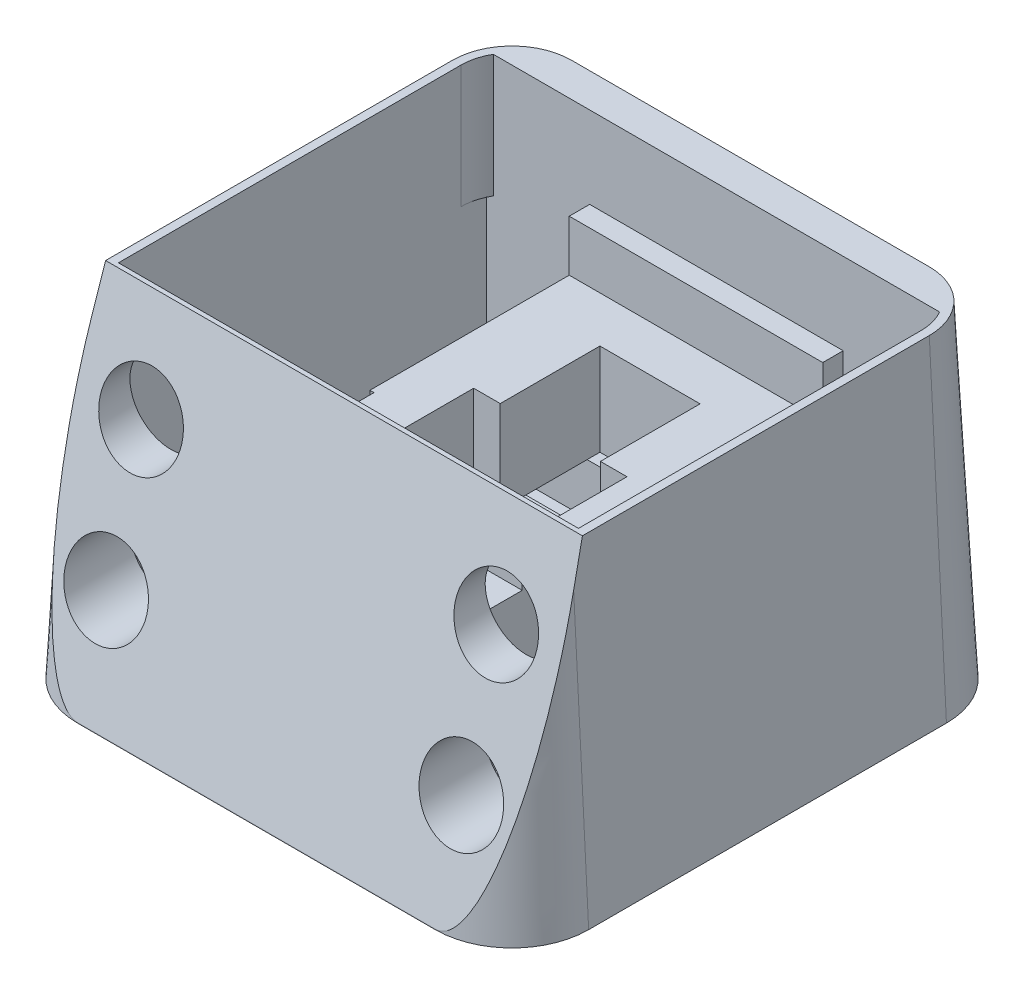
from build123d import *

# Parameters (mm, degrees)
BOSS_EXTRUDE1_DEPTH  = 10
SKETCH2_W            = 17.2
SKETCH2_H            = 43
CUT_EXTRUDE1_DEPTH   = 72.414284285
SKETCH3_W            = 90
SKETCH3_H            = 34
SKETCH3_W_2          = 80
SKETCH3_H_2          = 24
BOSS_EXTRUDE3_DEPTH  = 15
SKETCH4_W            = 49.6
SKETCH4_H            = 5
BOSS_EXTRUDE4_DEPTH  = 10
SKETCH5_W            = 15
SKETCH5_H            = 22
BOSS_EXTRUDE5_DEPTH  = 5
SKETCH6_W            = 90
SKETCH6_H            = 77
BOSS_EXTRUDE6_DEPTH  = 15
BOSS_EXTRUDE8_DEPTH  = 39
CHAMFER1_SIZE        = 64
CHAMFER1_SIZE_2      = 3.354097874
CHAMFER3_SIZE        = 64
CHAMFER3_SIZE_2      = 13.775745352
CUT_EXTRUDE6_DEPTH   = 2.5
CUT_EXTRUDE8_DEPTH   = 15
CUT_EXTRUDE9_DEPTH   = 15
SKETCH22_W           = 30
SKETCH22_H           = 7
CUT_EXTRUDE10_DEPTH  = 10
SKETCH25_R           = 8
CUT_EXTRUDE19_DEPTH  = 116.41230437
SKETCH29_W           = 9
SKETCH29_H           = 29
BOSS_EXTRUDE10_DEPTH = 28
SKETCH31_W           = 49.6
SKETCH31_H           = 13
BOSS_EXTRUDE12_DEPTH = 28
SKETCH30_W           = 49.6
SKETCH30_H           = 4
SKETCH30_W_2         = 48
BOSS_EXTRUDE11_DEPTH = 10
SKETCH33_W           = 15
SKETCH33_H           = 19.5
BOSS_EXTRUDE13_DEPTH = 13
SKETCH23_W           = 30
SKETCH23_H           = 28.995403325
CUT_EXTRUDE17_DEPTH  = 5
SKETCH34_W           = 9.8
SKETCH34_H           = 10.5
BOSS_EXTRUDE14_DEPTH = 28
SKETCH35_W           = 30
SKETCH35_H           = 10.5
CUT_EXTRUDE22_DEPTH  = 5
SKETCH37_W           = 30
SKETCH37_H           = 32.5
BOSS_EXTRUDE15_DEPTH = 5


with BuildPart() as part:
    # Sketch1 → Boss-Extrude1 (new body)
    with BuildSketch(Plane(origin=(0, 0, 0), x_dir=(1, 0, 0), z_dir=(0, 1, 0))):
        with BuildLine():
            Line((-35, 50), (35, 50))
            ThreePointArc((35, 50), (45.606601718, 45.606601718), (50, 35))
            Line((50, 35), (50, -35))
            ThreePointArc((50, -35), (45.606601718, -45.606601718), (35, -50))
            Line((35, -50), (-35, -50))
            ThreePointArc((-35, -50), (-45.606601718, -45.606601718), (-50, -35))
            Line((-50, -35), (-50, 35))
            ThreePointArc((-50, 35), (-45.606601718, 45.606601718), (-35, 50))
        make_face()
    extrude(amount=BOSS_EXTRUDE1_DEPTH)

    # Sketch2 → Cut-Extrude1 (cut, through all)
    with BuildSketch(Plane(origin=(0, 10, 0), x_dir=(1, 0, 0), z_dir=(0, 1, 0))):
        with Locations((-33.4, 18.5)):
            Rectangle(SKETCH2_W, SKETCH2_H)
        with Locations((33.4, 18.5)):
            Rectangle(SKETCH2_W, SKETCH2_H)
    extrude(amount=-CUT_EXTRUDE1_DEPTH, mode=Mode.SUBTRACT)

    # Sketch3 → Boss-Extrude3 (add)
    with BuildSketch(Plane(origin=(0, 10, 0), x_dir=(1, 0, 0), z_dir=(0, 1, 0))):
        with Locations((0, -20)):
            Rectangle(SKETCH3_W, SKETCH3_H)
        with Locations((0, -20)):
            Rectangle(SKETCH3_W_2, SKETCH3_H_2, mode=Mode.SUBTRACT)
    extrude(amount=BOSS_EXTRUDE3_DEPTH)

    # Sketch4 → Boss-Extrude4 (add)
    with BuildSketch(Plane(origin=(0, 10, 0), x_dir=(1, 0, 0), z_dir=(0, 1, 0))):
        with Locations((0, 10)):
            Rectangle(SKETCH4_W, SKETCH4_H)
        with Locations((0, 27)):
            Rectangle(SKETCH4_W, SKETCH4_H)
    extrude(amount=BOSS_EXTRUDE4_DEPTH)

    # Sketch5 → Boss-Extrude5 (add)
    with BuildSketch(Plane(origin=(0, 20, 0), x_dir=(1, 0, 0), z_dir=(0, 1, 0))):
        with Locations((-17.3, 18.5)):
            Rectangle(SKETCH5_W, SKETCH5_H)
        with Locations((17.3, 18.5)):
            Rectangle(SKETCH5_W, SKETCH5_H)
    extrude(amount=BOSS_EXTRUDE5_DEPTH)

    # Sketch6 → Boss-Extrude6 (add)
    with BuildSketch(Plane(origin=(0, 10, 0), x_dir=(1, 0, 0), z_dir=(0, 1, 0))):
        with BuildLine():
            Line((-50, 35), (-50, -35))
            ThreePointArc((-50, -35), (-45.606601718, -45.606601718), (-35, -50))
            Line((-35, -50), (35, -50))
            ThreePointArc((35, -50), (45.606601718, -45.606601718), (50, -35))
            Line((50, -35), (50, 35))
            ThreePointArc((50, 35), (45.606601718, 45.606601718), (35, 50))
            Line((35, 50), (-35, 50))
            ThreePointArc((-35, 50), (-45.606601718, 45.606601718), (-50, 35))
        make_face()
        with Locations((0, 1.5)):
            Rectangle(SKETCH6_W, SKETCH6_H, mode=Mode.SUBTRACT)
    extrude(amount=BOSS_EXTRUDE6_DEPTH)

    # Sketch9 → Boss-Extrude8 (add)
    with BuildSketch(Plane(origin=(0, 25, 0), x_dir=(1, 0, 0), z_dir=(0, 1, 0))):
        with BuildLine():
            Line((-50, 35), (-50, -35))
            ThreePointArc((-50, -35), (-45.606601718, -45.606601718), (-35, -50))
            Line((-35, -50), (35, -50))
            ThreePointArc((35, -50), (45.606601718, -45.606601718), (50, -35))
            Line((50, -35), (50, 35))
            ThreePointArc((50, 35), (45.606601718, 45.606601718), (35, 50))
            Line((35, 50), (-35, 50))
            ThreePointArc((-35, 50), (-45.606601718, 45.606601718), (-50, 35))
        make_face()
        with BuildLine():
            Line((-45, 35), (-45, -32))
            Line((-45, -32), (45, -32))
            Line((45, -32), (45, 35))
            ThreePointArc((45, 35), (44.659258263, 37.588190451), (43.660254038, 40))
            Line((43.660254038, 40), (-43.660254038, 40))
            ThreePointArc((-43.660254038, 40), (-44.659258263, 37.588190451), (-45, 35))
        make_face(mode=Mode.SUBTRACT)
    extrude(amount=BOSS_EXTRUDE8_DEPTH)

    # Chamfer1
    # the kernel refuses this chamfer: 64, 3.354097874 mm, written as the material it takes off along each edge
    with BuildSketch(Plane(origin=(-35, 64, 50), x_dir=(0, -0.9999979738662979, 0.002013023422382214), z_dir=(1, 0, 0)), Plane(origin=(50, 64, 35), x_dir=(0.002013023422382214, -0.9999979738662979, 0), z_dir=(0, 0, -1)), Plane(origin=(-50, 64, -35), x_dir=(-0.002013023422382214, -0.9999979738662979, 0), z_dir=(0, 0, 1)), Plane(origin=(35, 64, -50), x_dir=(0, -0.9999979738662979, -0.002013023422382214), z_dir=(-1, 0, 0))) as chamfer1_piece_1:
        Polygon((CHAMFER1_SIZE * 0.999997973866, CHAMFER1_SIZE * 0.00201302342238), (-CHAMFER1_SIZE_2 * 0.00201302342245, CHAMFER1_SIZE_2 * 0.9999979739), (0, 0), align=None)
    extrude(amount=70, mode=Mode.SUBTRACT)
    with BuildSketch(Plane(origin=(35, 64, 35), x_dir=(0, 0, 1), z_dir=(-1, 0, 0))) as chamfer1_piece_2:
        Polygon((15, -CHAMFER1_SIZE), (15 - CHAMFER1_SIZE_2, 0), (15, 0), align=None)
    revolve(axis=Axis((35, 64, 35), (0, 1, 0)), revolution_arc=90, mode=Mode.SUBTRACT)
    with BuildSketch(Plane(origin=(-35, 64, 35), x_dir=(-1, 0, 0), z_dir=(0, 0, -1))) as chamfer1_piece_3:
        Polygon((15, -CHAMFER1_SIZE), (15 - CHAMFER1_SIZE_2, 0), (15, 0), align=None)
    revolve(axis=Axis((-35, 64, 35), (0, 1, 0)), revolution_arc=90, mode=Mode.SUBTRACT)
    with BuildSketch(Plane(origin=(35, 64, -35), x_dir=(1, 0, 0), z_dir=(0, 0, 1))) as chamfer1_piece_4:
        Polygon((15, -CHAMFER1_SIZE), (15 - CHAMFER1_SIZE_2, 0), (15, 0), align=None)
    revolve(axis=Axis((35, 64, -35), (0, 1, 0)), revolution_arc=90, mode=Mode.SUBTRACT)
    with BuildSketch(Plane(origin=(-35, 64, -35), x_dir=(0, 0, -1), z_dir=(1, 0, 0))) as chamfer1_piece_5:
        Polygon((15 - CHAMFER1_SIZE_2, 0), (15, -CHAMFER1_SIZE), (15, 0), align=None)
    revolve(axis=Axis((-35, 64, -35), (0, 1, 0)), revolution_arc=90, mode=Mode.SUBTRACT)

    # Chamfer3
    # the kernel refuses this chamfer: 64, 13.775745352 mm, written as the material it takes off along each edge
    with BuildSketch(Plane(origin=(-201.265469314, 64, 46.645902126), x_dir=(0, -0.9981787050157903, 0.06032638604292662), z_dir=(1, 0, 0))) as chamfer3_piece_1:
        Polygon((CHAMFER3_SIZE * 0.999967974892, CHAMFER3_SIZE * 0.00800307379952), (-CHAMFER3_SIZE_2 * 0.060326386045, CHAMFER3_SIZE_2 * 0.99817870505), (0, 0), align=None)
    extrude(amount=402.530938629, mode=Mode.SUBTRACT)

    # Sketch17 → Cut-Extrude6 (cut)
    with BuildSketch(Plane(origin=(0, 0, -29.5), x_dir=(-1, 0, 0), z_dir=(0, 0, -1))):
        Polygon((-24.8, 10), (24.8, 10), (24.8, 25), (9.8, 25), (9.8, 20), (-9.8, 20), (-9.8, 25), (-24.8, 25), align=None)
    extrude(amount=-CUT_EXTRUDE6_DEPTH, mode=Mode.SUBTRACT)

    # Sketch20 → Cut-Extrude8 (cut)
    with BuildSketch(Plane.XZ.offset(-25)):
        with BuildLine():
            Line((-45, -35), (-45, -40))
            Line((-45, -40), (-43.660254038, -40))
            ThreePointArc((-43.660254038, -40), (-44.659258263, -37.588190451), (-45, -35))
        make_face()
        with BuildLine():
            Line((45, -40), (45, -35))
            ThreePointArc((45, -35), (44.659258263, -37.588190451), (43.660254038, -40))
            Line((43.660254038, -40), (45, -40))
        make_face()
    extrude(amount=-CUT_EXTRUDE8_DEPTH, mode=Mode.SUBTRACT)

    # Sketch21 → Cut-Extrude9 (cut)
    with BuildSketch(Plane(origin=(0, 25, 0), x_dir=(1, 0, 0), z_dir=(0, 1, 0))):
        Polygon((40, -8), (40, -32), (45, -32), (45, -3), (-45, -3), (-45, -32), (-40, -32), (-40, -8), align=None)
    extrude(amount=-CUT_EXTRUDE9_DEPTH, mode=Mode.SUBTRACT)

    # Sketch22 → Cut-Extrude10 (cut)
    with BuildSketch(Plane.XZ):
        with Locations((0, 28.5)):
            Rectangle(SKETCH22_W, SKETCH22_H)
    extrude(amount=-CUT_EXTRUDE10_DEPTH, mode=Mode.SUBTRACT)

    # Sketch25 → Cut-Extrude19 (cut, through all)
    with BuildSketch(Plane(origin=(0, 0, 32), x_dir=(-1, 0, 0), z_dir=(0, 0, -1))):
        with Locations((-34.75, 45.5)):
            Circle(SKETCH25_R)
        with Locations((34.75, 45.5)):
            Circle(SKETCH25_R)
        with Locations((-34.75, 20)):
            Circle(SKETCH25_R)
        with Locations((34.75, 20)):
            Circle(SKETCH25_R)
    extrude(amount=-CUT_EXTRUDE19_DEPTH, mode=Mode.SUBTRACT)

    # Sketch29 → Boss-Extrude10 (add)
    with BuildSketch(Plane(origin=(0, 10, 0), x_dir=(1, 0, 0), z_dir=(0, 1, 0))):
        with Locations((-19.5, -17.5)):
            Rectangle(SKETCH29_W, SKETCH29_H)
        with Locations((19.5, -17.5)):
            Rectangle(SKETCH29_W, SKETCH29_H)
    extrude(amount=BOSS_EXTRUDE10_DEPTH)

    # Sketch31 → Boss-Extrude12 (add)
    with BuildSketch(Plane(origin=(0, 10, 0), x_dir=(1, 0, 0), z_dir=(0, 1, 0))):
        with Locations((0, 33.5)):
            Rectangle(SKETCH31_W, SKETCH31_H)
    extrude(amount=BOSS_EXTRUDE12_DEPTH)

    # Sketch30 → Boss-Extrude11 (add)
    with BuildSketch(Plane(origin=(0, 38, 0), x_dir=(1, 0, 0), z_dir=(0, 1, 0))):
        with Locations((0, 38)):
            Rectangle(SKETCH30_W, SKETCH30_H)
        with Locations((0, -20)):
            Rectangle(SKETCH30_W_2, SKETCH30_H)
    extrude(amount=BOSS_EXTRUDE11_DEPTH)

    # Sketch33 → Boss-Extrude13 (add)
    with BuildSketch(Plane(origin=(0, 25, 0), x_dir=(1, 0, 0), z_dir=(0, 1, 0))):
        with Locations((17.3, 17.25)):
            Rectangle(SKETCH33_W, SKETCH33_H)
        with Locations((-17.3, 17.25)):
            Rectangle(SKETCH33_W, SKETCH33_H)
    extrude(amount=BOSS_EXTRUDE13_DEPTH)

    # Sketch23 → Cut-Extrude17 (cut)
    with BuildSketch(Plane(origin=(0, 10, 0), x_dir=(1, 0, 0), z_dir=(0, 1, 0))):
        with Locations((0, -17.497701662)):
            Rectangle(SKETCH23_W, SKETCH23_H)
    extrude(amount=-CUT_EXTRUDE17_DEPTH, mode=Mode.SUBTRACT)

    # Sketch34 → Boss-Extrude14 (add)
    with BuildSketch(Plane(origin=(0, 10, 0), x_dir=(1, 0, 0), z_dir=(0, 1, 0))):
        with Locations((-19.9, 2.25)):
            Rectangle(SKETCH34_W, SKETCH34_H)
        with Locations((19.9, 2.25)):
            Rectangle(SKETCH34_W, SKETCH34_H)
    extrude(amount=BOSS_EXTRUDE14_DEPTH)

    # Sketch35 → Cut-Extrude22 (cut)
    with BuildSketch(Plane(origin=(0, 10, 0), x_dir=(1, 0, 0), z_dir=(0, 1, 0))):
        with Locations((0, 2.25)):
            Rectangle(SKETCH35_W, SKETCH35_H)
    extrude(amount=-CUT_EXTRUDE22_DEPTH, mode=Mode.SUBTRACT)

    # Sketch37 → Boss-Extrude15 (add)
    with BuildSketch(Plane(origin=(0, 5, 0), x_dir=(1, 0, 0), z_dir=(0, 1, 0))):
        with Locations((0, -8.75)):
            Rectangle(SKETCH37_W, SKETCH37_H)
    extrude(amount=BOSS_EXTRUDE15_DEPTH)


solid = part.part
